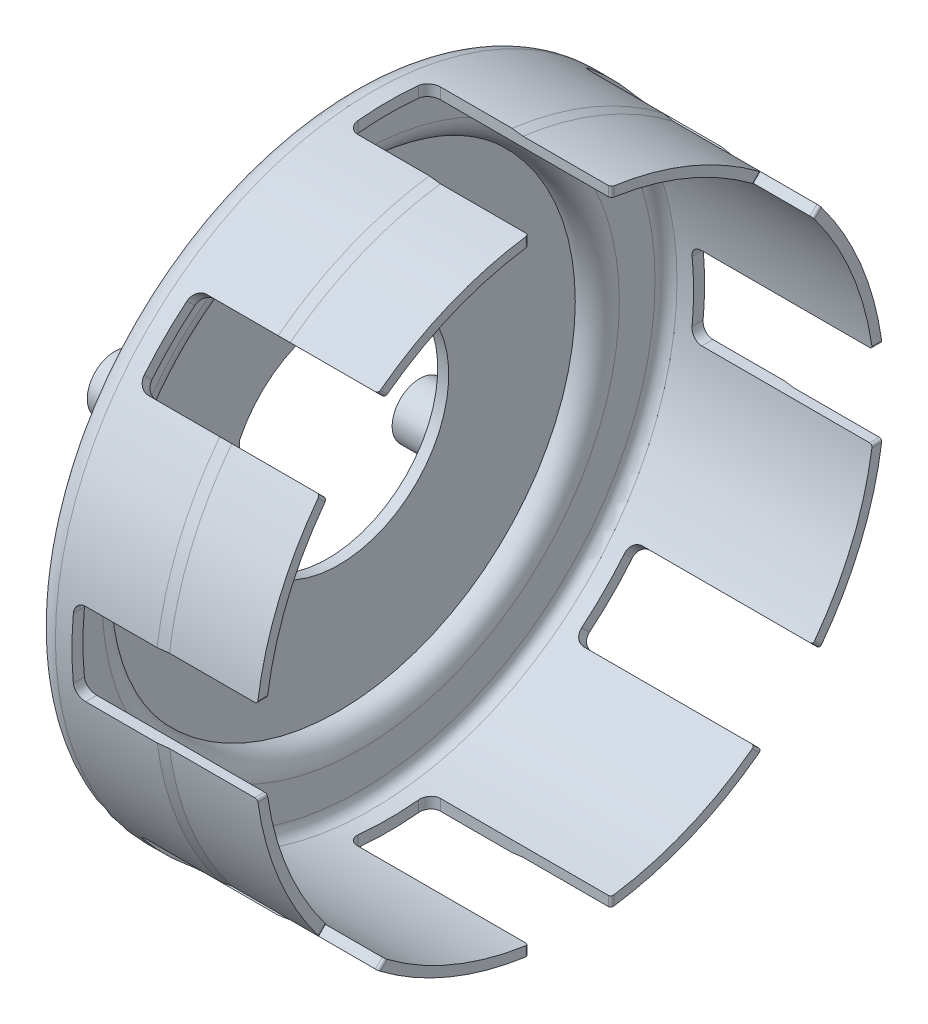
from build123d import *

# Parameters (mm, degrees)
FILLET1_R                = 4
FILLET2_R                = 2
CUT_EXTRUDE1_DEPTH       = 93.45809868
SKETCH2_3_R              = 5
SKETCH2_3_R_2            = 2
BOSS_EXTRUDE1_DEPTH      = 11
FILLET3_R                = 0.5
CIRPATTERN1_COUNT        = 6
FILLET3_OF_CIRPATTERN1_R = 0.5
CUT_EXTRUDE2_DEPTH       = 99.170769639
FILLET4_R                = 0.5
CIRPATTERN2_COUNT        = 8
FILLET4_OF_CIRPATTERN2_R = 0.5


# Read off the part's stored shape, not the designer's step: Shell1
with BuildPart() as part:
    # Sketch1 → Revolve2 (revolve)
    with BuildSketch(Plane(origin=(0, 0, 0), x_dir=(-1, 0, 0), z_dir=(0, 1, 0)), mode=Mode.PRIVATE) as revolve2_sk:
        Polygon((0, 57.5), (40, 57.5), (40, 45), (44, 45), (44, 0), (0, 0), align=None)
    revolve(revolve2_sk.sketch.rotate(Axis((113.845707204, 0, 0), (-1, 0, 0)), 180), axis=Axis((113.845707204, 0, 0), (-1, 0, 0)))

    # Fillet1
    fillet1_edges = [part.edges().sort_by_distance(p)[0] for p in [
        (-40, 0, 57.5),
    ]]
    fillet(fillet1_edges, radius=FILLET1_R)

    # Fillet2
    fillet2_edges = [part.edges().sort_by_distance(p)[0] for p in [
        (-44, 0, 45),
        (-40, 0, 45),
    ]]
    fillet(fillet2_edges, radius=FILLET2_R - 0.0001)  # a hair under: the kernel refuses the full size

    # Shell1 outline → Shell1 (revolve, cut)
    with BuildSketch(Plane.YX):
        with BuildLine():
            ThreePointArc((53.5, -38), (54.914213562, -37.414213562), (55.5, -36))
            Line((55.5, -36), (55.5, 0))
            Line((55.5, 0), (0, 0))
            Line((0, 0), (0, -42))
            Line((0, -42), (43, -42))
            ThreePointArc((43, -42), (44.171572875, -39.171572875), (47, -38))
            Line((47, -38), (53.5, -38))
        make_face()
    revolve(axis=Axis((0, 0, 0), (1, 0, 0)), mode=Mode.SUBTRACT)

    # Sketch2 → Cut-Extrude1 (cut, through all)
    with BuildSketch(Plane(origin=(-44, 0, 0), x_dir=(0, -1, 0), z_dir=(-1, 0, 0))):
        with BuildLine():
            Line((-8.717797887, 18), (8.717797887, 18))
            ThreePointArc((8.717797887, 18), (0, -20), (-8.717797887, 18))
        make_face()
    extrude(amount=-CUT_EXTRUDE1_DEPTH, mode=Mode.SUBTRACT)

    # Sketch2<3> → Boss-Extrude1 (add)
    with BuildSketch(Plane(origin=(-44, 0, 0), x_dir=(0, -1, 0), z_dir=(-1, 0, 0))):
        with Locations(Location((32, 0, 0), (0, 0, 270))):
            Circle(SKETCH2_3_R)
        with Locations(Location((32, 0, 0), (0, 0, 270))):
            Circle(SKETCH2_3_R_2, mode=Mode.SUBTRACT)
    boss_extrude1 = extrude(amount=BOSS_EXTRUDE1_DEPTH)

    # Fillet3
    fillet3_edges = [part.edges().sort_by_distance(p)[0] for p in [
        (-44, -32, 5),
    ]]
    fillet(fillet3_edges, radius=FILLET3_R)

    # CirPattern1: Boss-Extrude1 ×6 about axis
    cirpattern1_axis = Axis((0, 0, 0), (1, 0, 0))
    for i in range(1, CIRPATTERN1_COUNT):
        add(boss_extrude1.rotate(cirpattern1_axis, i * 360 / CIRPATTERN1_COUNT))

    # Fillet3 of CirPattern1
    fillet3_of_cirpattern1_edges = [part.edges().sort_by_distance(p)[0] for p in [
        (-44, -20.330127019, -25.212812921),
        (-44, 11.669872981, -30.212812921),
        (-44, 32, -5),
        (-44, 20.330127019, 25.212812921),
        (-44, -11.669872981, 30.212812921),
    ]]
    fillet(fillet3_of_cirpattern1_edges, radius=FILLET3_OF_CIRPATTERN1_R)

    # Sketch3 → Cut-Extrude2 (cut, through all)
    with BuildSketch(Plane(origin=(0, 0, 0), x_dir=(-1, 0, 0), z_dir=(0, 1, 0))):
        with BuildLine():
            Line((0, 7.5), (31, 7.5))
            ThreePointArc((31, 7.5), (32.414213562, 6.914213562), (33, 5.5))
            Line((33, 5.5), (33, -5.5))
            ThreePointArc((33, -5.5), (32.414213562, -6.914213562), (31, -7.5))
            Line((31, -7.5), (0, -7.5))
            Line((0, -7.5), (0, 7.5))
        make_face()
    cut_extrude2 = extrude(amount=-CUT_EXTRUDE2_DEPTH, mode=Mode.SUBTRACT)

    # Fillet4
    fillet4_edges = [part.edges().sort_by_distance(p)[0] for p in [
        (0, -55.999839797, -7.5),
        (0, -55.999839797, 7.5),
    ]]
    fillet(fillet4_edges, radius=FILLET4_R)

    # CirPattern2: Cut-Extrude2 ×8 about axis
    cirpattern2_axis = Axis((0, 0, 0), (1, 0, 0))
    for i in range(1, CIRPATTERN2_COUNT):
        add(cut_extrude2.rotate(cirpattern2_axis, i * 360 / CIRPATTERN2_COUNT), mode=Mode.SUBTRACT)

    # Fillet4 of CirPattern2
    fillet4_of_cirpattern2_edges = [part.edges().sort_by_distance(p)[0] for p in [
        (0, -34.294565607, -44.901167325),
        (0, -44.901167325, -34.294565607),
        (0, 7.5, -55.999839797),
        (0, -7.5, -55.999839797),
        (0, 44.901167325, -34.294565607),
        (0, 34.294565607, -44.901167325),
        (0, 55.999839797, 7.5),
        (0, 55.999839797, -7.5),
        (0, 34.294565607, 44.901167325),
        (0, 44.901167325, 34.294565607),
        (0, -7.5, 55.999839797),
        (0, 7.5, 55.999839797),
        (0, -44.901167325, 34.294565607),
        (0, -34.294565607, 44.901167325),
    ]]
    fillet(fillet4_of_cirpattern2_edges, radius=FILLET4_OF_CIRPATTERN2_R)

    # Sketch6 → Cut-Revolve5 (revolve, cut)
    with BuildSketch(Plane(origin=(0, 0, 0), x_dir=(0, 1, 0), z_dir=(0, 0, 1)), mode=Mode.PRIVATE) as cut_revolve5_sk:
        Polygon((-57.5, 18), (-57.25, 16), (-57.25, 0), (-57.5, 0), align=None)
    revolve(cut_revolve5_sk.sketch.rotate(Axis((-17.232382132, 0, 0), (1, 0, 0)), 90), axis=Axis((-17.232382132, 0, 0), (1, 0, 0)), mode=Mode.SUBTRACT)


solid = part.part
